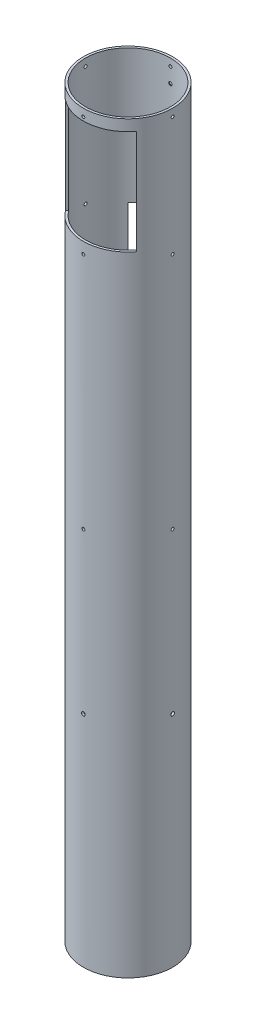
from build123d import *

# Parameters (mm, degrees)
SKETCH1_W                       = 3
SKETCH1_H                       = 1000
CUT_EXTRUDE1_START              = -15
CUT_EXTRUDE1_DEPTH              = 140
CUT_EXTRUDE2_START              = -180
CUT_EXTRUDE2_DEPTH              = 300
F_4_0MM_DOWEL_HOLE1_D           = 4
F_4_0MM_DOWEL_HOLE1_ON_FACE_2_D = 4
F_4_0MM_DOWEL_HOLE1_ON_FACE_3_D = 4
F_4_0MM_DOWEL_HOLE1_ON_FACE_4_D = 4
F_4_0MM_DOWEL_HOLE1_ON_FACE_5_D = 4
F_5_0MM_DOWEL_HOLE1_D           = 5
F_5_0MM_DOWEL_HOLE1_ON_FACE_2_D = 5
F_5_0MM_DOWEL_HOLE1_ON_FACE_3_D = 5
F_5_0MM_DOWEL_HOLE1_ON_FACE_4_D = 5


# Read off the part's stored shape, not the designer's step: CSK for M4 Hex Socket Countersunk Cap Screw1
with BuildPart() as part:
    # Sketch1 → Revolve1 (revolve)
    with BuildSketch(Plane.XY, mode=Mode.PRIVATE) as revolve1_sk:
        with Locations((58.5, 0)):
            Rectangle(SKETCH1_W, SKETCH1_H)
    revolve(revolve1_sk.sketch.rotate(Axis((0, 0, 0), (0, 1, 0)), 90), axis=Axis((0, 0, 0), (0, 1, 0)))

    # Sketch4 → Cut-Extrude1 (cut)
    with BuildSketch(Plane(origin=(0, 500, 0), x_dir=(1, 0, 0), z_dir=(0, 1, 0)).offset(CUT_EXTRUDE1_START)):
        with BuildLine():
            Line((-47.704446333, -36.390737834), (-45.562994128, -34.249285629))
            ThreePointArc((-45.562994128, -34.249285629), (0, -57), (45.562994128, -34.249285629))
            Line((45.562994128, -34.249285629), (47.704446333, -36.390737834))
            ThreePointArc((47.704446333, -36.390737834), (0, -60), (-47.704446333, -36.390737834))
        make_face()
    extrude(amount=-CUT_EXTRUDE1_DEPTH, mode=Mode.SUBTRACT)

    # Sketch6 → Cut-Extrude2 (cut)
    with BuildSketch(Plane(origin=(0, 500, 0), x_dir=(1, 0, 0), z_dir=(0, 1, 0)).offset(CUT_EXTRUDE2_START)):
        with BuildLine():
            ThreePointArc((42.426406871, 42.426406871), (0, 60), (-42.426406871, 42.426406871))
            Line((-42.426406871, 42.426406871), (-40.305086528, 40.305086528))
            ThreePointArc((-40.305086528, 40.305086528), (0, 57), (40.305086528, 40.305086528))
            Line((40.305086528, 40.305086528), (42.426406871, 42.426406871))
        make_face()
    extrude(amount=-CUT_EXTRUDE2_DEPTH, mode=Mode.SUBTRACT)

    # Ø4.0mm Dowel Hole1 (through all)
    with Locations(Plane(origin=(0, 490, 60), x_dir=(1, 0, 0), z_dir=(0, 0, 1))):
        with Locations((0, 0), (0, -160), (0, -480)):
            Hole(F_4_0MM_DOWEL_HOLE1_D / 2)

    # Ø4.0mm Dowel Hole1 on face 2 (through all)
    with Locations(Plane(origin=(60, 490, 0), x_dir=(0, 0, 1), z_dir=(1, 0, 0))):
        with Locations((0, 0), (0, 160), (0, 480)):
            Hole(F_4_0MM_DOWEL_HOLE1_ON_FACE_2_D / 2)

    # Ø4.0mm Dowel Hole1 on face 3 (through all)
    with Locations(Plane(origin=(0, 490, -60), x_dir=(-1, 0, 0), z_dir=(0, 0, -1))):
        with Locations((0, 0), (0, -160), (0, -480)):
            Hole(F_4_0MM_DOWEL_HOLE1_ON_FACE_3_D / 2)

    # Ø4.0mm Dowel Hole1 on face 4 (through all)
    with Locations(Plane(origin=(-60, 490, 0), x_dir=(0, 0, -1), z_dir=(-1, 0, 0))):
        with Locations((0, 0), (0, 160), (0, 480)):
            Hole(F_4_0MM_DOWEL_HOLE1_ON_FACE_4_D / 2)

    # Ø4.0mm Dowel Hole1 on face 5 (through all)
    with Locations(Plane(origin=(0, 330, 0), x_dir=(1, 0, 0), z_dir=(0, 0, 1))):
        with Locations((0, 0)):
            Hole(F_4_0MM_DOWEL_HOLE1_ON_FACE_5_D / 2)

    # Ø5.0mm Dowel Hole1 (through all)
    with Locations(Plane(origin=(-60, -205, 0), x_dir=(0, 0, -1), z_dir=(-1, 0, 0))):
        with Locations((0, 0)):
            Hole(F_5_0MM_DOWEL_HOLE1_D / 2)

    # Ø5.0mm Dowel Hole1 on face 2 (through all)
    with Locations(Plane(origin=(0, -205, 60), x_dir=(1, 0, 0), z_dir=(0, 0, 1))):
        with Locations((0, 0)):
            Hole(F_5_0MM_DOWEL_HOLE1_ON_FACE_2_D / 2)

    # Ø5.0mm Dowel Hole1 on face 3 (through all)
    with Locations(Plane(origin=(60, -205, 0), x_dir=(0, 0, 1), z_dir=(1, 0, 0))):
        with Locations((0, 0)):
            Hole(F_5_0MM_DOWEL_HOLE1_ON_FACE_3_D / 2)

    # Ø5.0mm Dowel Hole1 on face 4 (through all)
    with Locations(Plane(origin=(0, -205, -60), x_dir=(-1, 0, 0), z_dir=(0, 0, -1))):
        with Locations((0, 0)):
            Hole(F_5_0MM_DOWEL_HOLE1_ON_FACE_4_D / 2)

    # CSK for M4 Hex Socket Countersunk Ca 2 → CSK for M4 Hex Socket Countersunk Cap Screw1 (revolve, cut)
    with BuildSketch(Plane.XZ.offset(-470)):
        Polygon((2.25, -57.77), (2.25, -56.955555783), (0, -56.955555783), (0, -60.000000574), (4.480000574, -60.000000574), align=None)
    revolve(axis=Axis((0, 470, 0), (0, 0, 1)), mode=Mode.SUBTRACT)

    # CSK for M4 Hex Socket Countersunk Ca 3 o → CSK for M4 Hex Socket Countersunk Ca 3 (revolve, cut)
    with BuildSketch(Plane.XZ.offset(-360)):
        Polygon((2.25, -57.77), (2.25, -56.955555783), (0, -56.955555783), (0, -60.000000574), (4.480000574, -60.000000574), align=None)
    revolve(axis=Axis((0, 360, 0), (0, 0, 1)), mode=Mode.SUBTRACT)


solid = part.part
